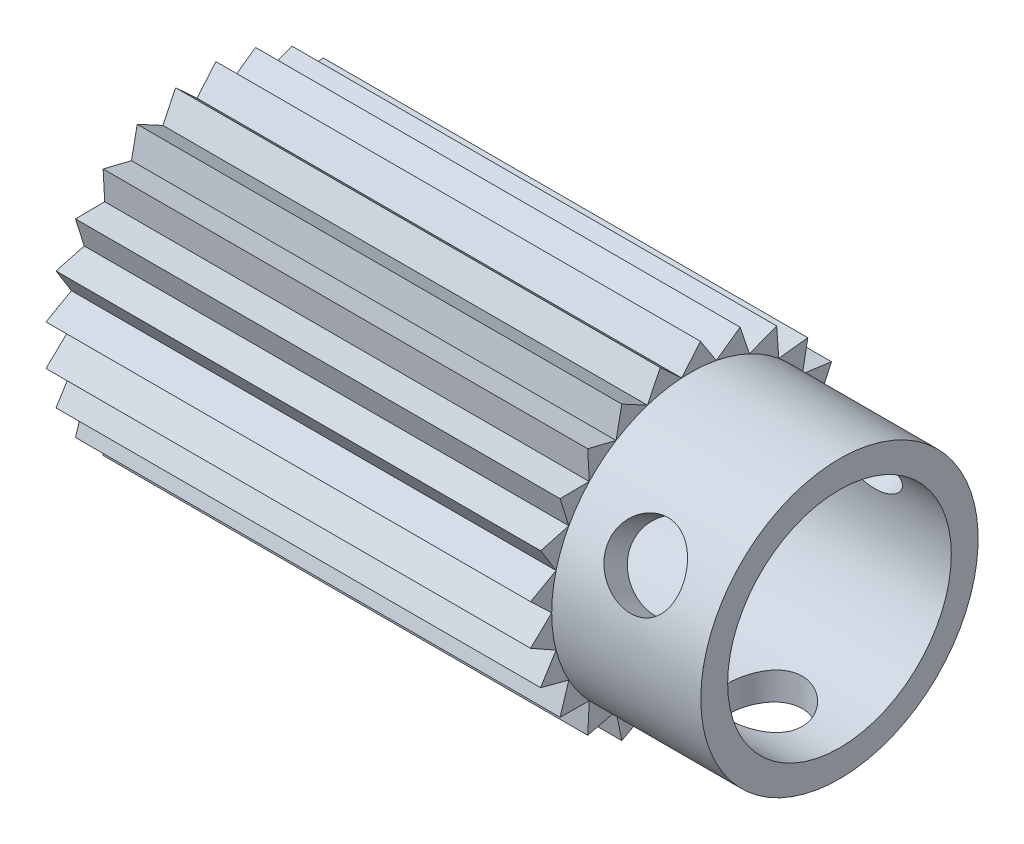
from build123d import *

# Parameters (mm, degrees)
SKETCH2_R          = 3.175
CUT_EXTRUDE1_DEPTH = 38.600633721
CIRPATTERN1_COUNT  = 3
SKETCH3_R          = 15.875
CUT_EXTRUDE2_DEPTH = 59.457949723


with BuildPart() as part:
    # Sketch1 → Revolve1 (revolve)
    with BuildSketch(Plane(origin=(0, 0, 0), x_dir=(1, 0, 0), z_dir=(0, 1, 0))):
        Polygon((-30.1625, -15.875), (-30.1625, -6.35), (-23.8125, -6.35), (-23.8125, -9.525), (23.8125, -9.525), (23.8125, -11.811), (11.1125, -11.811), (11.1125, -15.875), align=None)
    revolve(axis=Axis((-42.066572288, 0, 0), (1, 0, 0)))

    # Sketch2 → Cut-Extrude1 (cut, through all)
    with BuildSketch(Plane(origin=(0, 0, 0), x_dir=(1, 0, 0), z_dir=(0, 1, 0))):
        with Locations((17.4625, 0)):
            Circle(SKETCH2_R)
    cut_extrude1 = extrude(amount=-CUT_EXTRUDE1_DEPTH, mode=Mode.SUBTRACT)

    # CirPattern1: Cut-Extrude1 ×3 about axis
    cirpattern1_axis = Axis((-42.066572288, 0, 0), (1, 0, 0))
    for i in range(1, CIRPATTERN1_COUNT):
        add(cut_extrude1.rotate(cirpattern1_axis, i * 360 / CIRPATTERN1_COUNT), mode=Mode.SUBTRACT)

    # Sketch3 → Cut-Extrude2 (cut, through all)
    with BuildSketch(Plane.ZY.offset(30.1625)):
        Circle(SKETCH3_R)
        Polygon((13.607845243, 1.719070632), (11.811, 0), (13.607845243, -1.719070632), (11.439935716, -2.937276257), (12.75281428, -5.049196365), (10.350058198, -5.689992645), (11.096477095, -8.06206252), (8.609848458, -8.085185868), (8.742907443, -10.568359638), (6.328650275, -9.972357128), (5.839988763, -12.410607852), (3.649799721, -11.232928514), (2.570122111, -13.473051931), (0.741618826, -11.787693689), (-0.861234766, -13.688934607), (-2.213160707, -11.601794718), (-4.238477095, -13.044691178), (-5.028879213, -10.686912317), (-7.34940032, -11.580801826), (-7.528614743, -9.10053191), (-9.998533694, -9.389248105), (-9.555299721, -6.942331615), (-12.019422423, -6.607733394), (-10.981590075, -4.347919092), (-13.285086638, -3.411030492), (-11.717866737, -1.480310822), (-13.716, 0), (-11.717866737, 1.480310822), (-13.285086638, 3.411030492), (-10.981590075, 4.347919092), (-12.019422423, 6.607733394), (-9.555299721, 6.942331615), (-9.998533694, 9.389248105), (-7.528614743, 9.10053191), (-7.34940032, 11.580801826), (-5.028879213, 10.686912317), (-4.238477095, 13.044691178), (-2.213160707, 11.601794718), (-0.861234766, 13.688934607), (0.741618826, 11.787693689), (2.570122111, 13.473051931), (3.649799721, 11.232928514), (5.839988763, 12.410607852), (6.328650275, 9.972357128), (8.742907443, 10.568359638), (8.609848458, 8.085185868), (11.096477095, 8.06206252), (10.350058198, 5.689992645), (12.75281428, 5.049196365), (11.439935716, 2.937276257), align=None, mode=Mode.SUBTRACT)
    extrude(amount=-CUT_EXTRUDE2_DEPTH, mode=Mode.SUBTRACT)


solid = part.part
